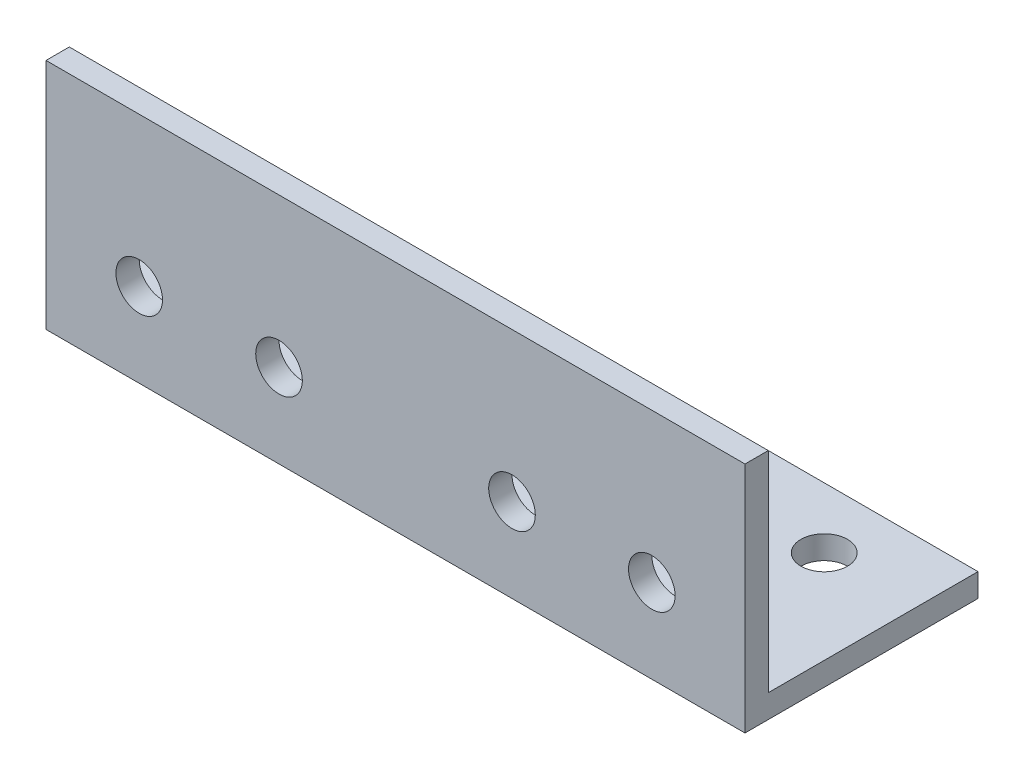
from build123d import *

# Parameters (mm, degrees)
EXTRUDE_1_DEPTH     = 150
SKETCH_2_R          = 5
CUT_EXTRUDE_1_DEPTH = 166.831239518
SKETCH_3_R          = 5
CUT_EXTRUDE_3_DEPTH = 166.831239518


with BuildPart() as part:
    # Эскиз1 → Вытянуть-Тонкостенный1 (new body)
    with BuildSketch(Plane(origin=(0, 0, 0), x_dir=(0, 0, -1), z_dir=(1, 0, 0))):
        Polygon((50, 0), (0, 0), (0, 50), (5, 50), (5, 5), (50, 5), align=None)
    extrude(amount=EXTRUDE_1_DEPTH)

    # Эскиз2 → Вырез-Вытянуть1 (cut, through all)
    with BuildSketch(Plane.XZ):
        with Locations((130, -37)):
            Circle(SKETCH_2_R)
        with Locations((100, -37)):
            Circle(SKETCH_2_R)
        with Locations((50, -37)):
            Circle(SKETCH_2_R)
        with Locations((20, -37)):
            Circle(SKETCH_2_R)
    extrude(amount=-CUT_EXTRUDE_1_DEPTH, mode=Mode.SUBTRACT)

    # Эскиз3 → Вырез-Вытянуть3 (cut, through all)
    with BuildSketch(Plane.XY):
        with Locations((130, 18)):
            Circle(SKETCH_3_R)
        with Locations((100, 18)):
            Circle(SKETCH_3_R)
        with Locations((50, 18)):
            Circle(SKETCH_3_R)
        with Locations((20, 18)):
            Circle(SKETCH_3_R)
    extrude(amount=-CUT_EXTRUDE_3_DEPTH, mode=Mode.SUBTRACT)


solid = part.part
